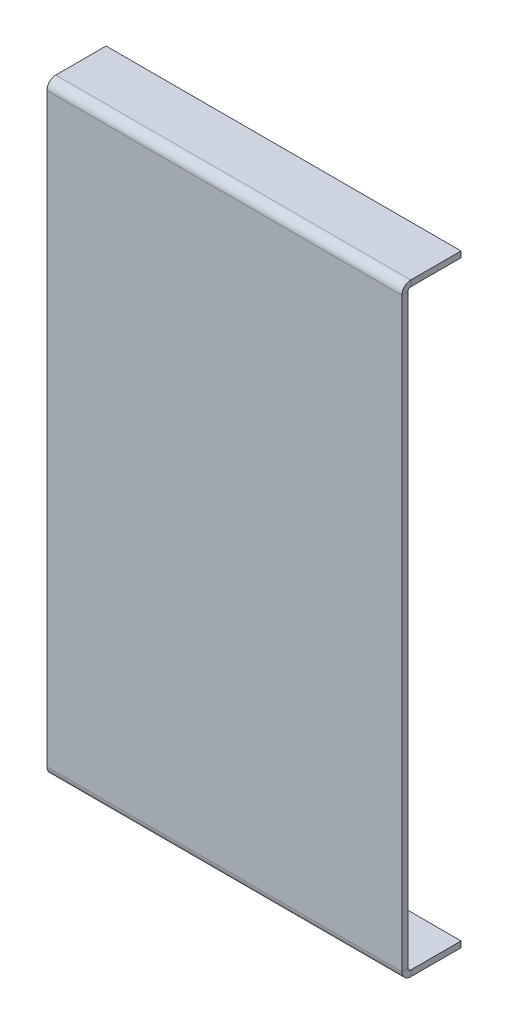
from build123d import *

# Parameters (mm, degrees)
SKETCH_1_W                         = 120
SKETCH_1_H                         = 204
SM_BASE_FLANGE_1_DEPTH             = 2
SM_EDGE_FLANGE_1_STRIP_W           = 10
SM_EDGE_FLANGE_1_STRIP_H           = 2
SM_EDGE_FLANGE_1_STRIP_CUT_DEPTH   = 120
SM_EDGE_FLANGE_1_STRIP_2_W         = 10
SM_EDGE_FLANGE_1_STRIP_2_H         = 2
SM_EDGE_FLANGE_1_STRIP_CUT_2_DEPTH = 120
SM_EDGE_FLANGE_1_DEPTH             = 120
SM_EDGE_FLANGE_1_BEND_DEPTH        = 120


# Sheet-metal steps are written as plain solids
with BuildPart() as part:
    # Sketch 1 → 基体-法兰1 (new body)
    with BuildSketch(Plane.XY):
        Rectangle(SKETCH_1_W, SKETCH_1_H)
    extrude(amount=-SM_BASE_FLANGE_1_DEPTH)

    # 边线-法兰1 strip (across the edge) → 边线-法兰1 strip cut (cut)
    with BuildSketch(Plane(origin=(-60, 102, -2), x_dir=(0, -1, 0), z_dir=(1, 0, 0))):
        with Locations((-2, -1)):
            Rectangle(SM_EDGE_FLANGE_1_STRIP_W, SM_EDGE_FLANGE_1_STRIP_H)
    extrude(amount=SM_EDGE_FLANGE_1_STRIP_CUT_DEPTH, mode=Mode.SUBTRACT)

    # 边线-法兰1 strip 2 (across the edge) → 边线-法兰1 strip cut 2 (cut)
    with BuildSketch(Plane(origin=(60, -102, -2), x_dir=(0, 1, 0), z_dir=(-1, 0, 0))):
        with Locations((-2, -1)):
            Rectangle(SM_EDGE_FLANGE_1_STRIP_2_W, SM_EDGE_FLANGE_1_STRIP_2_H)
    extrude(amount=SM_EDGE_FLANGE_1_STRIP_CUT_2_DEPTH, mode=Mode.SUBTRACT)

    # 边线-法兰1 section (across the edge) → 边线-法兰1 (add)
    with BuildSketch(Plane(origin=(-60, 102, -2), x_dir=(0, -1, 0), z_dir=(1, 0, 0))):
        with BuildLine():
            Line((0, 1), (0, 18))
            Line((0, 18), (2, 18))
            Line((2, 18), (2, 1))
            ThreePointArc((2, 1), (2.292893219, 0.292893219), (3, 0))
            Line((3, 0), (3, -2))
            ThreePointArc((3, -2), (0.878679656, -1.121320344), (0, 1))
        make_face()
    extrude(amount=SM_EDGE_FLANGE_1_DEPTH)

    # 边线-法兰1 section 2 (across the edge) → 边线-法兰1 bend (add)
    with BuildSketch(Plane(origin=(60, -102, -2), x_dir=(0, 1, 0), z_dir=(-1, 0, 0))):
        with BuildLine():
            Line((0, 1), (0, 18))
            Line((0, 18), (2, 18))
            Line((2, 18), (2, 1))
            ThreePointArc((2, 1), (2.292893219, 0.292893219), (3, 0))
            Line((3, 0), (3, -2))
            ThreePointArc((3, -2), (0.878679656, -1.121320344), (0, 1))
        make_face()
    extrude(amount=SM_EDGE_FLANGE_1_BEND_DEPTH)


solid = part.part
